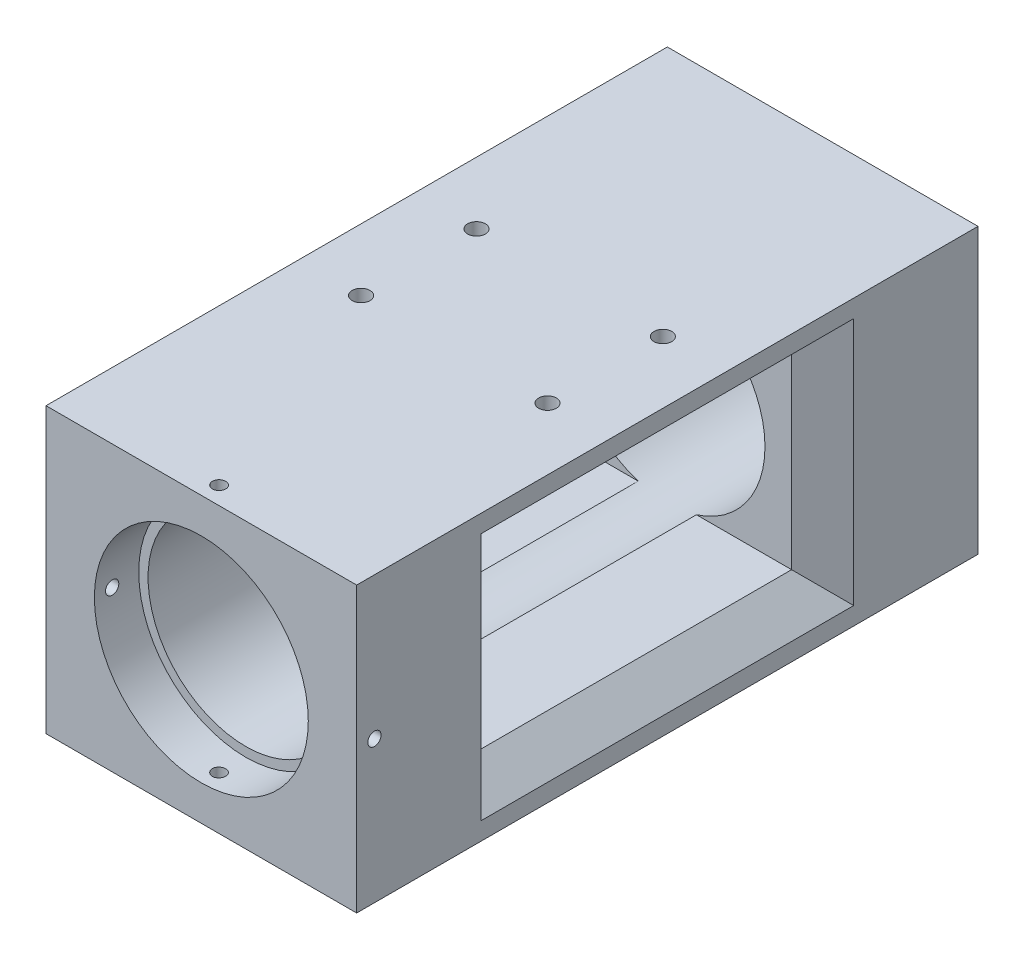
from build123d import *

# Parameters (mm, degrees)
SKETCH_1_W                 = 70
SKETCH_1_H                 = 64
EXTRUDE_1_DEPTH            = 70
SKETCH_2_R                 = 24.1
CUT_EXTRUDE_1_DEPTH        = 10
SKETCH_3_R                 = 1.5
CUT_EXTRUDE_2_DEPTH        = 102.098961419
SKETCH_4_R                 = 1.5
CUT_EXTRUDE_3_DEPTH        = 105.038454527
SKETCH_5_R                 = 22
CUT_EXTRUDE_4_DEPTH        = 139.379911885
SKETCH_6_W                 = 70
SKETCH_6_H                 = 42
CUT_EXTRUDE_5_DEPTH        = 105.038454594
CHAMFER_1_SIZE             = 7
SKETCH_7_R                 = 2
CUT_EXTRUDE_6_DEPTH        = 20
CUT_EXTRUDE_START          = -7
SKETCH_8_R                 = 5.5
SKETCH_8_R_2               = 2
CUT_EXTRUDE_7_DEPTH        = 7
MIRROR_START               = -7
MIRROR_2_COPY_1_SKETCH_R   = 5.5
MIRROR_2_COPY_1_SKETCH_R_2 = 2
MIRROR_2_COPY_1_DEPTH      = 7


with BuildPart() as part:
    # 草图1 → 凸台-拉伸1 (new, symmetric)
    with BuildSketch(Plane.XY):
        Rectangle(SKETCH_1_W, SKETCH_1_H)
    extrude(amount=EXTRUDE_1_DEPTH, both=True)

    # 草图2 → 切除-拉伸1 (cut)
    with BuildSketch(Plane.XY.offset(70)):
        Circle(SKETCH_2_R)
    extrude(amount=-CUT_EXTRUDE_1_DEPTH, mode=Mode.SUBTRACT)

    # 草图3 → 切除-拉伸2 (cut, through all)
    with BuildSketch(Plane(origin=(0, 32, 0), x_dir=(1, 0, 0), z_dir=(0, 1, 0))):
        with Locations((0, -66)):
            Circle(SKETCH_3_R)
    extrude(amount=-CUT_EXTRUDE_2_DEPTH, mode=Mode.SUBTRACT)

    # 草图4 → 切除-拉伸3 (cut, through all)
    with BuildSketch(Plane(origin=(35, 0, 0), x_dir=(0, 0, -1), z_dir=(1, 0, 0))):
        with Locations((-66, 0)):
            Circle(SKETCH_4_R)
    extrude(amount=-CUT_EXTRUDE_3_DEPTH, mode=Mode.SUBTRACT)

    # 草图5 → 切除-拉伸4 (cut, through all)
    with BuildSketch(Plane.XY.offset(60)):
        Circle(SKETCH_5_R)
    extrude(amount=-CUT_EXTRUDE_4_DEPTH, mode=Mode.SUBTRACT)

    # 草图6 → 切除-拉伸5 (cut, through all)
    with BuildSketch(Plane(origin=(35, 0, 0), x_dir=(0, 0, -1), z_dir=(1, 0, 0))):
        Rectangle(SKETCH_6_W, SKETCH_6_H)
    extrude(amount=-CUT_EXTRUDE_5_DEPTH, mode=Mode.SUBTRACT)

    # 倒角1
    chamfer_1_edges = [part.edges().sort_by_distance(p)[0] for p in [
        (-35, 0, -35),
        (-35, -21, 0),
        (-35, 0, 35),
        (-35, 21, 0),
        (35, 21, 0),
        (35, 0, -35),
        (35, 0, 35),
        (35, -21, 0),
    ]]
    chamfer(chamfer_1_edges, length=CHAMFER_1_SIZE)

    # 草图7 → 切除-拉伸6 (cut)
    with BuildSketch(Plane(origin=(0, 32, 0), x_dir=(1, 0, 0), z_dir=(0, 1, 0))):
        with Locations((-21, 13)):
            Circle(SKETCH_7_R)
        with Locations((21, 13)):
            Circle(SKETCH_7_R)
    cut_extrude_6 = extrude(amount=-CUT_EXTRUDE_6_DEPTH, mode=Mode.SUBTRACT)

    # 草图8 → 切除-拉伸7 (cut)
    with BuildSketch(Plane.XZ.offset(-21).offset(CUT_EXTRUDE_START)):
        with Locations((21, -13)):
            Circle(SKETCH_8_R)
        with Locations((21, -13)):
            Circle(SKETCH_8_R_2, mode=Mode.SUBTRACT)
    cut_extrude_7 = extrude(amount=CUT_EXTRUDE_7_DEPTH, mode=Mode.SUBTRACT)

    # 镜向1: 切除-拉伸7 across plane
    add(cut_extrude_7.mirror(Plane(origin=(0, 0, 0), x_dir=(0, 0, 1), z_dir=(1, 0, 0))), mode=Mode.SUBTRACT)

    # 镜向2: 切除-拉伸6, 切除-拉伸7 across plane
    add(cut_extrude_6.mirror(Plane.XY), mode=Mode.SUBTRACT)
    add(cut_extrude_7.mirror(Plane.XY), mode=Mode.SUBTRACT)

    # 镜向2 copy 1 sketch → 镜向2 copy 1 (cut)
    with BuildSketch(Plane(origin=(0, 21, 0), x_dir=(-1, 0, 0), z_dir=(0, -1, 0)).offset(MIRROR_START)):
        with Locations((21, -13)):
            Circle(MIRROR_2_COPY_1_SKETCH_R)
        with Locations((21, -13)):
            Circle(MIRROR_2_COPY_1_SKETCH_R_2, mode=Mode.SUBTRACT)
    extrude(amount=MIRROR_2_COPY_1_DEPTH, mode=Mode.SUBTRACT)


solid = part.part
